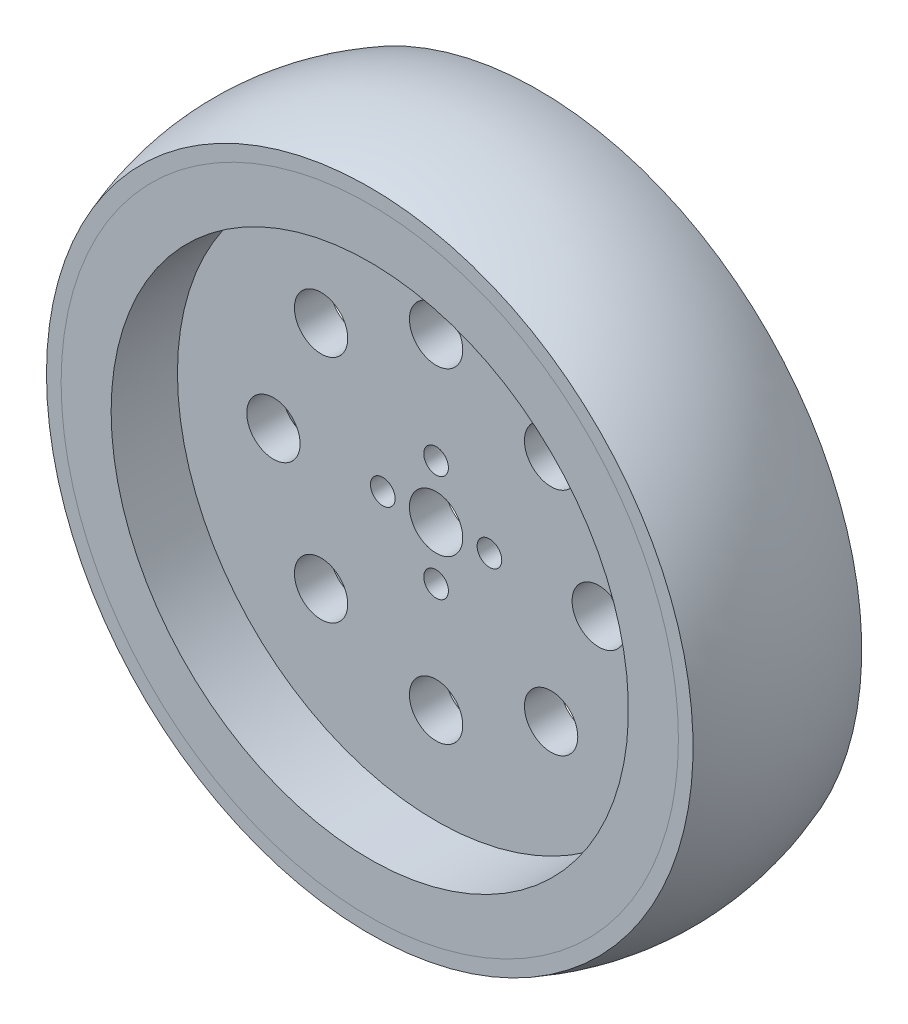
from build123d import *

# Parameters (mm, degrees)
CUT_EXTRUDE1_DEPTH      = 73.947258501
CUT_EXTRUDE1_DEPTH_BACK = 73.947258501
SKETCH3_R               = 1.85
SKETCH3_R_2             = 4


with BuildPart() as part:
    # Sketch1 → Revolve1 (revolve)
    with BuildSketch(Plane(origin=(0, 0, 0), x_dir=(1, 0, 0), z_dir=(0, 1, 0))):
        Polygon((4, -2.7), (38.8, -2.7), (38.8, -12.65), (46.3, -12.65), (46.3, -10.65), (44, -10.65), (44, 10.65), (46.3, 10.65), (46.3, 12.65), (38.8, 12.65), (38.8, 2.7), (4, 2.7), align=None)
    revolve(axis=Axis((0, 0, -12.65), (0, 0, 1)))

    # Sketch3 → Cut-Extrude1 (cut, two sides: drawn at the far end of the back side and taken through both)
    with BuildSketch(Plane.XY.offset(-CUT_EXTRUDE1_DEPTH_BACK)):
        with Locations((0, 8)):
            Circle(SKETCH3_R)
        with Locations((8, 0)):
            Circle(SKETCH3_R)
        with Locations((0, -8)):
            Circle(SKETCH3_R)
        with Locations((-8, 0)):
            Circle(SKETCH3_R)
        with Locations((0, 24.4)):
            Circle(SKETCH3_R_2)
        with Locations((17.253405461, 17.253405461)):
            Circle(SKETCH3_R_2)
        with Locations((24.4, 0)):
            Circle(SKETCH3_R_2)
        with Locations((17.253405461, -17.253405461)):
            Circle(SKETCH3_R_2)
        with Locations((0, -24.4)):
            Circle(SKETCH3_R_2)
        with Locations((-17.253405461, -17.253405461)):
            Circle(SKETCH3_R_2)
        with Locations((-24.4, 0)):
            Circle(SKETCH3_R_2)
        with Locations((-17.253405461, 17.253405461)):
            Circle(SKETCH3_R_2)
    extrude(amount=CUT_EXTRUDE1_DEPTH + CUT_EXTRUDE1_DEPTH_BACK, mode=Mode.SUBTRACT)


with BuildPart() as body_2:
    # Sketch2 → Revolve2 (revolve)
    with BuildSketch(Plane(origin=(0, 0, 0), x_dir=(1, 0, 0), z_dir=(0, 1, 0))):
        with BuildLine():
            Line((44, -10.65), (44, 10.65))
            Line((44, 10.65), (46.3, 10.65))
            Line((46.3, 10.65), (46.3, 12.65))
            Line((46.3, 12.65), (48.5, 12.65))
            ThreePointArc((48.5, 12.65), (50.8, 0), (48.5, -12.65))
            Line((48.5, -12.65), (46.3, -12.65))
            Line((46.3, -12.65), (46.3, -10.65))
            Line((46.3, -10.65), (44, -10.65))
        make_face()
    revolve(axis=Axis((0, 0, -12.65), (0, 0, 1)))


solid = Compound([part.part, body_2.part])
